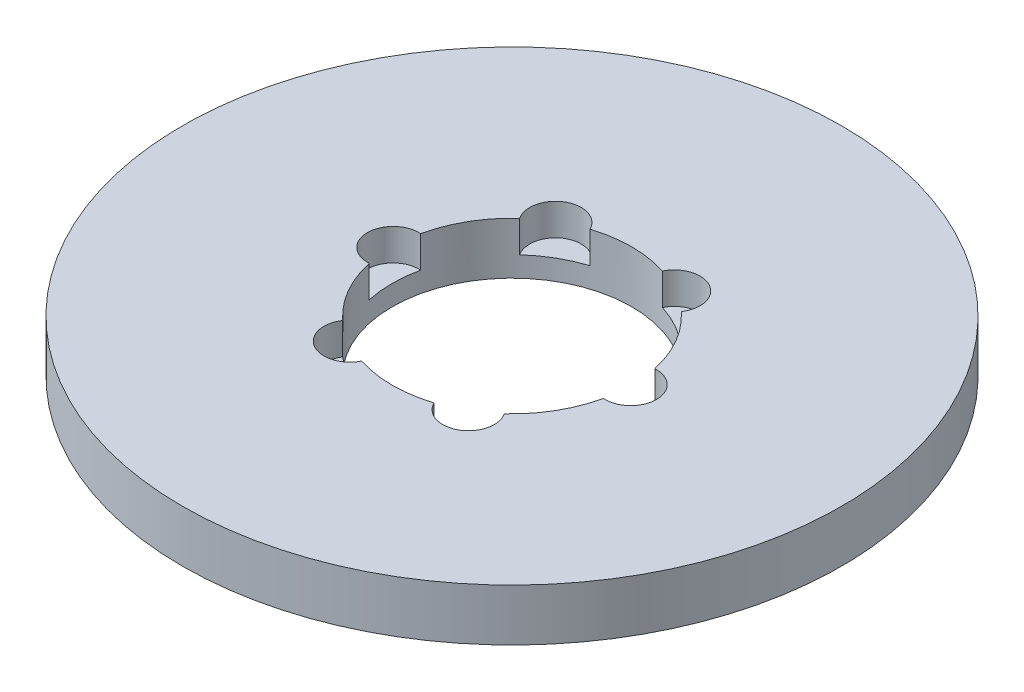
from build123d import *

# Parameters (mm, degrees)
SKETCH1_R           = 82.5
BOSS_EXTRUDE1_DEPTH = 13
SKETCH2_R           = 30
CUT_EXTRUDE1_DEPTH  = 118.394633608
SKETCH3_R           = 6.451717482
CUT_EXTRUDE2_DEPTH  = 7.9216986
CIRPATTERN1_COUNT   = 6


with BuildPart() as part:
    # Sketch1 → Boss-Extrude1 (new body)
    with BuildSketch(Plane(origin=(0, 0, 0), x_dir=(1, 0, 0), z_dir=(0, 1, 0))):
        Circle(SKETCH1_R)
    extrude(amount=BOSS_EXTRUDE1_DEPTH)

    # Sketch2 → Cut-Extrude1 (cut, through all)
    with BuildSketch(Plane(origin=(0, 0, 0), x_dir=(1, 0, 0), z_dir=(0, 1, 0))):
        Circle(SKETCH2_R)
    extrude(amount=CUT_EXTRUDE1_DEPTH, mode=Mode.SUBTRACT)

    # Sketch3 → Cut-Extrude2 (cut)
    with BuildSketch(Plane(origin=(0, 13, 0), x_dir=(1, 0, 0), z_dir=(0, 1, 0))):
        with Locations((-29.738341357, 0)):
            Circle(SKETCH3_R)
    cut_extrude2 = extrude(amount=-CUT_EXTRUDE2_DEPTH, mode=Mode.SUBTRACT)

    # CirPattern1: Cut-Extrude2 ×6 about axis
    cirpattern1_axis = Axis((0, 0, 0), (0, 1, 0))
    for i in range(1, CIRPATTERN1_COUNT):
        add(cut_extrude2.rotate(cirpattern1_axis, i * 360 / CIRPATTERN1_COUNT), mode=Mode.SUBTRACT)


solid = part.part
